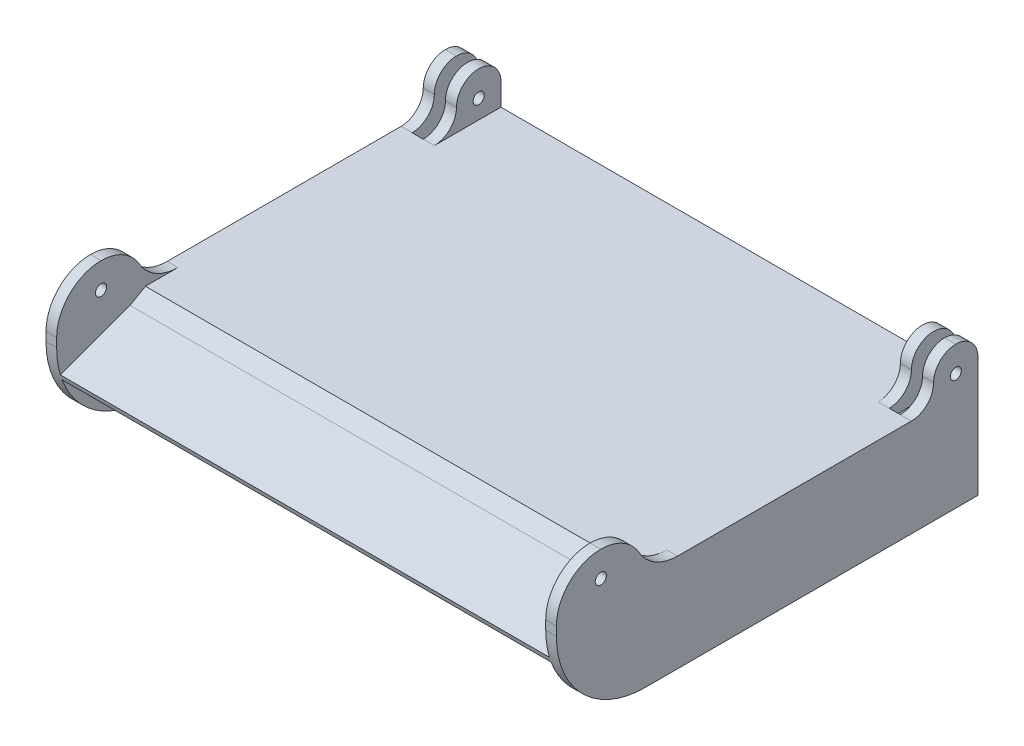
from build123d import *

# Parameters (mm, degrees)
BOSS_EXTRUDE1_DEPTH  = 2.54
SKETCH2_W            = 3.048
SKETCH2_H            = 25.4
BOSS_EXTRUDE2_DEPTH  = 12.7
FILLET5_R            = 12.7
FILLET6_R            = 12.7
FILLET7_R            = 12.7
FILLET8_R            = 12.7
SKETCH3_R            = 1.5875
CUT_EXTRUDE1_DEPTH   = 187.084255379
SKETCH4_W            = 12.7
SKETCH4_H            = 12.7
SKETCH4_R            = 1.5875
BOSS_EXTRUDE3_DEPTH  = 3.175
BOSS_EXTRUDE4_DEPTH  = 6.35
FILLET10_R           = 6.35
FILLET11_R           = 6.35
SKETCH6_W            = 3.175
SKETCH6_H            = 19.05
CUT_EXTRUDE2_DEPTH   = 3.175
BOSS_EXTRUDE5_DEPTH  = 25.4
FILLET12_R           = 25.4
SKETCH8_W            = 133.35
SKETCH8_H            = 3.175
BOSS_EXTRUDE6_DEPTH  = 25.4
BOSS_EXTRUDE9_DEPTH  = 114.554
CUT_EXTRUDE3_REACH   = 177.181
BOSS_EXTRUDE10_DEPTH = 12.7
BOSS_EXTRUDE11_DEPTH = 12.7
CUT_EXTRUDE4_DEPTH   = 185.822136131
FILLET15_R           = 101.6
SKETCH14_R           = 1.5875
BOSS_EXTRUDE12_DEPTH = 3.175


# Some blends are built 0.0001 mm under size
with BuildPart() as part:
    # Sketch1 → Boss-Extrude1 (new body)
    with BuildSketch(Plane(origin=(0, 0, 0), x_dir=(1, 0, 0), z_dir=(0, 1, 0))):
        Polygon((15.748, -114.3), (130.302, -114.3), (130.302, -88.9), (143.002, -88.9), (143.002, -114.3), (146.05, -114.3), (146.05, 0), (0, 0), (0, -114.3), (3.048, -114.3), (3.048, -88.9), (15.748, -88.9), align=None)
    extrude(amount=BOSS_EXTRUDE1_DEPTH)

    # Sketch2 → Boss-Extrude2 (add)
    with BuildSketch(Plane(origin=(0, 2.54, 0), x_dir=(1, 0, 0), z_dir=(0, 1, 0))):
        with Locations((1.524, -101.6)):
            Rectangle(SKETCH2_W, SKETCH2_H)
    boss_extrude2 = extrude(amount=BOSS_EXTRUDE2_DEPTH)

    # Mirror1: Boss-Extrude2 across plane
    add(boss_extrude2.mirror(Plane(origin=(73.025, 0, 0), x_dir=(0, 0, 1), z_dir=(1, 0, 0))))

    # Fillet5
    fillet5_edges = [part.edges().sort_by_distance(p)[0] for p in [
        (1.524, 15.24, 114.3),
        (1.524, 15.24, 88.9),
    ]]
    fillet(fillet5_edges, radius=FILLET5_R - 0.0001)  # a hair under: the kernel refuses the full size

    # Fillet6
    # the kernel refuses this fillet: 12.7 mm, written as the material it adds along each edge
    with BuildSketch(Plane(origin=(3.048, 2.54, 88.9), x_dir=(0, 0.9659271393953295, 0.25881414447351125), z_dir=(-1, 0, 0))) as fillet6_piece_1:
        with BuildLine():
            CenterArc((9.861056917, 12.267248789), FILLET6_R, 194.99970931, 60.000130236)
            Line((-2.406217753, 8.980309154), (-3.63294522, 8.65161519))
            Line((-3.63294522, 8.65161519), (-1.226727467, -0.328693963))
            Line((-1.226727467, -0.328693963), (0.328693963, -1.226727467))
            ThreePointArc((0.328693963, -1.226727467), (0.328790556, -1.226701586), (6.245317068, -1.226724879))
            Line((6.245317068, -1.226724879), (6.574020691, 0))
        make_face()
    extrude(amount=3.048)

    # Fillet7
    fillet7_edges = [part.edges().sort_by_distance(p)[0] for p in [
        (144.526, 15.24, 88.9),
        (144.526, 15.24, 114.3),
    ]]
    fillet(fillet7_edges, radius=FILLET7_R - 0.0001)  # a hair under: the kernel refuses the full size

    # Fillet8
    # the kernel refuses this fillet: 12.7 mm, written as the material it adds along each edge
    with BuildSketch(Plane(origin=(143.002, 2.54, 88.9), x_dir=(0, 0, -1), z_dir=(1, 0, 0))) as fillet8_piece_1:
        with BuildLine():
            CenterArc((9.297087521, 12.7), FILLET8_R, 209.999869764, 60.000130236)
            Line((-1.701449541, 6.350025), (-2.801303247, 5.7150275))
            ThreePointArc((-2.801303247, 5.7150275), (-1.27, 0.0001), (-1.27, 0))
            Line((-1.27, 0), (0, -1.27))
            Line((0, -1.27), (9.297087521, -1.27))
            Line((9.297087521, -1.27), (9.297087521, 0))
        make_face()
    extrude(amount=3.048)

    # Sketch3 → Cut-Extrude1 (cut, through all)
    with BuildSketch(Plane(origin=(146.05, 0, 0), x_dir=(0, 0, -1), z_dir=(1, 0, 0))):
        with Locations((-101.6, 7.935875783)):
            Circle(SKETCH3_R)
    extrude(amount=-CUT_EXTRUDE1_DEPTH, mode=Mode.SUBTRACT)

    # Sketch4 → Boss-Extrude3 (add)
    with BuildSketch(Plane(origin=(146.05, 0, 0), x_dir=(0, 0, -1), z_dir=(1, 0, 0))):
        with Locations((0, 8.89)):
            Rectangle(SKETCH4_W, SKETCH4_H)
        with Locations((0, 7.935875783)):
            Circle(SKETCH4_R, mode=Mode.SUBTRACT)
    boss_extrude3 = extrude(amount=-BOSS_EXTRUDE3_DEPTH)

    # Sketch5 → Boss-Extrude4 (add)
    with BuildSketch(Plane(origin=(0, 0, 0), x_dir=(-1, 0, 0), z_dir=(0, 0, -1))):
        Polygon((-146.05, 0), (0, 0), (0, 2.54), (-142.875, 2.54), (-146.05, 2.54), align=None)
    extrude(amount=BOSS_EXTRUDE4_DEPTH)

    # Mirror2: Boss-Extrude3 across plane
    add(boss_extrude3.mirror(Plane(origin=(73.025, 0, 0), x_dir=(0, 0, 1), z_dir=(1, 0, 0))))

    # Fillet10
    fillet10_edges = [part.edges().sort_by_distance(p)[0] for p in [
        (1.5875, 15.24, 6.35),
        (1.5875, 15.24, -6.35),
        (144.4625, 15.24, -6.35),
        (144.4625, 15.24, 6.35),
    ]]
    fillet(fillet10_edges, radius=FILLET10_R - 0.0001)  # a hair under: the kernel refuses the full size

    # Fillet11
    fillet11_edges = [part.edges().sort_by_distance(p)[0] for p in [
        (1.5875, 2.54, 6.35),
        (144.4625, 2.54, 6.35),
    ]]
    fillet(fillet11_edges, radius=FILLET11_R)

    # Sketch6 → Cut-Extrude2 (cut)
    with BuildSketch(Plane.XZ):
        with Locations((141.2875, 3.175)):
            Rectangle(SKETCH6_W, SKETCH6_H)
    cut_extrude2 = extrude(amount=-CUT_EXTRUDE2_DEPTH, mode=Mode.SUBTRACT)

    # Mirror3: Cut-Extrude2 across plane
    add(cut_extrude2.mirror(Plane(origin=(73.025, 0, 0), x_dir=(0, 0, 1), z_dir=(1, 0, 0))), mode=Mode.SUBTRACT)

    # Sketch7 → Boss-Extrude5 (add)
    with BuildSketch(Plane.XZ):
        Polygon((143.002, 114.3), (146.05, 114.3), (146.05, -6.35), (142.875, -6.35), (142.875, 12.7), (143.002, 88.9), align=None)
    boss_extrude5 = extrude(amount=BOSS_EXTRUDE5_DEPTH)

    # Mirror4: Boss-Extrude5 across plane
    add(boss_extrude5.mirror(Plane(origin=(73.025, 0, 0), x_dir=(0, 0, 1), z_dir=(1, 0, 0))))

    # Fillet12
    fillet12_edges = [part.edges().sort_by_distance(p)[0] for p in [
        (1.524, -25.4, 114.3),
        (144.526, -25.4, 114.3),
    ]]
    fillet(fillet12_edges, radius=FILLET12_R)

    # Sketch8 → Boss-Extrude6 (add)
    with BuildSketch(Plane.XZ):
        with Locations((73.025, -4.7625)):
            Rectangle(SKETCH8_W, SKETCH8_H)
    extrude(amount=BOSS_EXTRUDE6_DEPTH)

    # Sketch9 → Boss-Extrude9 (add)
    with BuildSketch(Plane.ZY.offset(-15.748)):
        Polygon((114.3, -9.24484395), (114.3, -7.643590007), (93.299409051, 0), (88.9, 0), align=None)
    extrude(amount=-BOSS_EXTRUDE9_DEPTH)

    # Sketch10 → Cut-Extrude3 (cut, up to next)
    with BuildSketch(Plane.ZY.offset(-15.748), mode=Mode.PRIVATE) as cut_extrude3_sk1:
        Polygon((93.299409051, 0), (88.9, 2.54), (114.3, 2.54), (114.3, 0), align=None)
    cut_extrude3_tool1 = extrude(cut_extrude3_sk1.sketch, amount=-CUT_EXTRUDE3_REACH, mode=Mode.PRIVATE) & part.part
    add(cut_extrude3_tool1.solids().sort_by_distance((15.748, 1.310138, 102.665092))[0], mode=Mode.SUBTRACT)

    # Sketch11 → Boss-Extrude10 (add)
    with BuildSketch(Plane.ZY.offset(-15.748)):
        Polygon((114.3, -7.643590007), (93.299409051, 0), (88.9, 2.54), (88.9, 0), (114.3, -9.24484395), align=None)
    extrude(amount=BOSS_EXTRUDE10_DEPTH)

    # Sketch12 → Boss-Extrude11 (add)
    with BuildSketch(Plane(origin=(130.302, 0, 0), x_dir=(0, 0, -1), z_dir=(1, 0, 0))):
        Polygon((-88.9, 0), (-88.9, 2.54), (-93.299409051, 0), (-114.3, -7.643590007), (-114.3, -9.24484395), align=None)
    extrude(amount=BOSS_EXTRUDE11_DEPTH)

    # Sketch13 → Cut-Extrude4 (cut, through all)
    with BuildSketch(Plane.ZY.offset(-3.048)):
        with BuildLine():
            Line((114.3, -7.643590007), (113.240908135, -7.258112093))
            ThreePointArc((113.240908135, -7.258112093), (113.015140482, -7.976214611), (112.768192568, -8.68731164))
            Line((112.768192568, -8.68731164), (114.3, -9.24484395))
            Line((114.3, -9.24484395), (114.3, -7.643590007))
        make_face()
    extrude(amount=-CUT_EXTRUDE4_DEPTH, mode=Mode.SUBTRACT)

    # Fillet15
    fillet15_edges = [part.edges().sort_by_distance(p)[0] for p in [
        (73.025, 0, 88.9),
    ]]
    fillet(fillet15_edges, radius=FILLET15_R)

    # Sketch14 → Boss-Extrude12 (add)
    with BuildSketch(Plane.ZY.offset(-6.35)):
        with BuildLine():
            Line((-6.35, 2.54), (12.7, 2.54))
            ThreePointArc((12.7, 2.54), (8.209871939, 4.399871939), (6.35, 8.89))
            ThreePointArc((6.35, 8.89), (4.490128061, 13.380128061), (0, 15.24))
            ThreePointArc((0, 15.24), (-4.490128061, 13.380128061), (-6.35, 8.89))
            Line((-6.35, 8.89), (-6.35, 2.54))
        make_face()
        with Locations(Location((0, 7.935875783, 0), (0, 0, 180))):
            Circle(SKETCH14_R, mode=Mode.SUBTRACT)
    boss_extrude12 = extrude(amount=-BOSS_EXTRUDE12_DEPTH)

    # Mirror5: Boss-Extrude12 across plane
    add(boss_extrude12.mirror(Plane(origin=(73.025, 0, 0), x_dir=(0, 0, 1), z_dir=(1, 0, 0))))


solid = part.part
